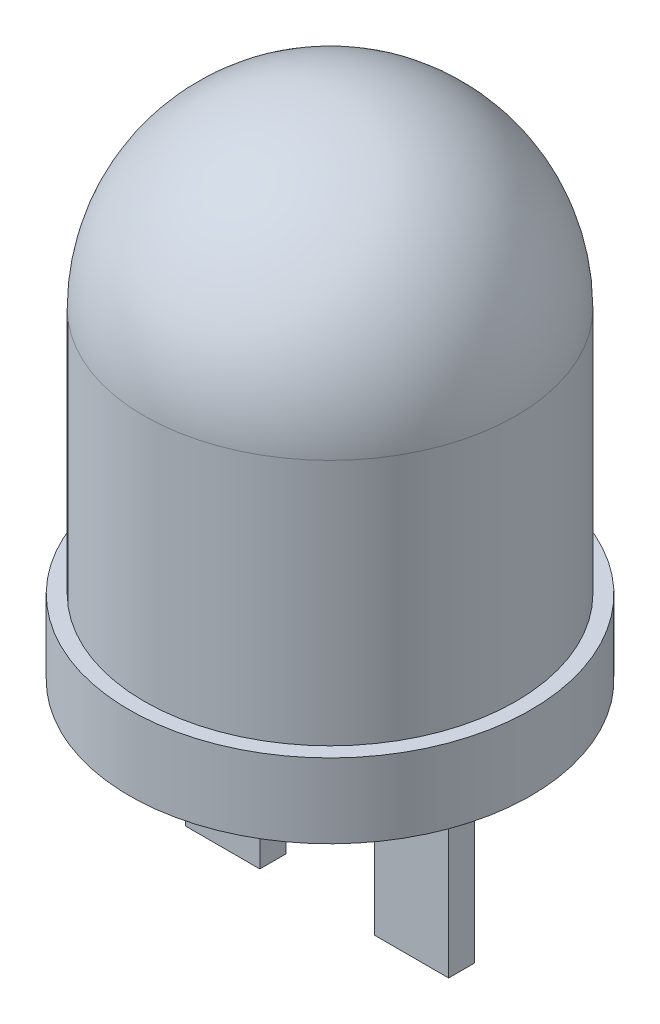
from build123d import *

# Parameters (mm, degrees)
BOSS_EXTRUDE1_DEPTH      = 5
BOSS_EXTRUDE1_DEPTH_BACK = 5
SKETCH2_W                = 2
SKETCH2_H                = 0.7


with BuildPart() as part:
    # Sketch1 → Revolve1 (revolve)
    with BuildSketch(Plane.XY):
        with BuildLine():
            Line((0, 0), (0, 13.65))
            ThreePointArc((0, 13.65), (3.535533906, 12.185533906), (5, 8.65))
            Line((5, 8.65), (5, 2))
            Line((5, 2), (5.4, 2))
            Line((5.4, 2), (5.4, 0))
            Line((5.4, 0), (0, 0))
        make_face()
    revolve(axis=Axis((0, 0, 0), (0, 1, 0)))

    # Sketch2 → Boss-Extrude1 (add, two sides: drawn at the far end of the back side and taken through both)
    with BuildSketch(Plane.XZ.offset(-BOSS_EXTRUDE1_DEPTH_BACK)):
        with Locations((2.54, 0)):
            Rectangle(SKETCH2_W, SKETCH2_H)
        with Locations((-2.54, 0)):
            Rectangle(SKETCH2_W, SKETCH2_H)
    extrude(amount=BOSS_EXTRUDE1_DEPTH + BOSS_EXTRUDE1_DEPTH_BACK)


solid = part.part
